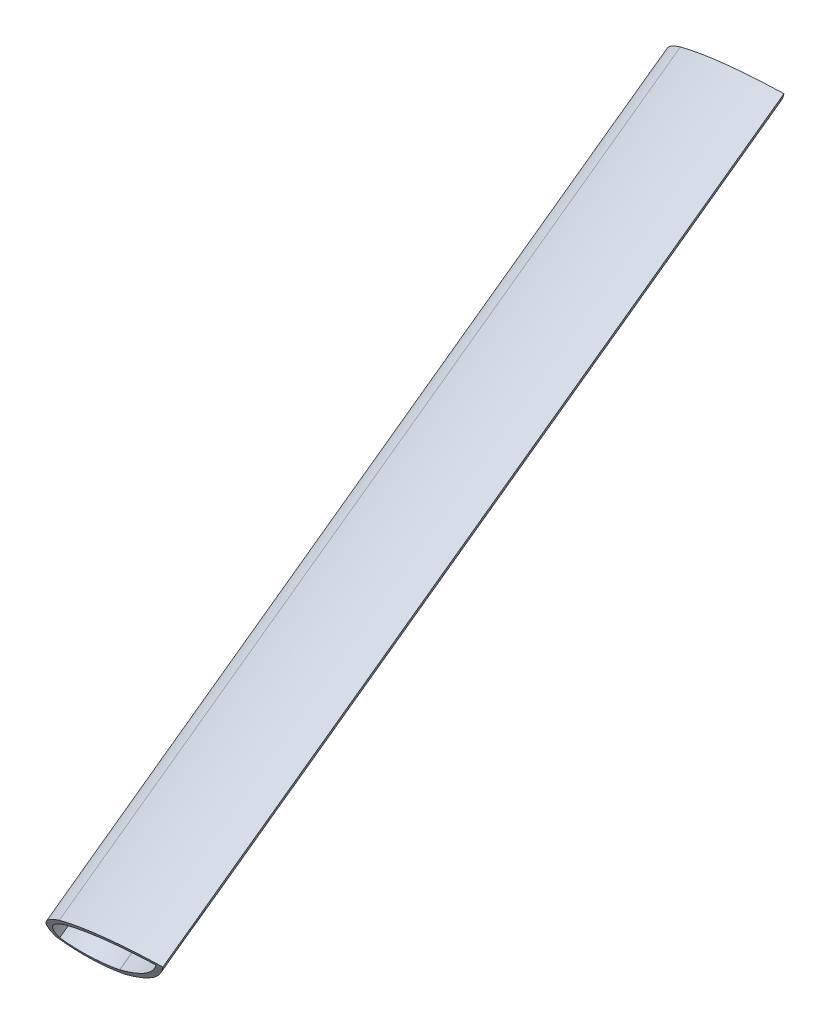
from build123d import *

# Parameters (mm, degrees)
BOSS_EXTRUDE1_DEPTH      = 91.359952
BOSS_EXTRUDE1_DEPTH_BACK = 91.359952
SKETCH1_R                = 6.35
SKETCH2_R                = 5.1943
CUT_EXTRUDE1_DEPTH       = 1020.644650611
EXTRUDE_THIN2_START      = -177.8
EXTRUDE_THIN2_DEPTH      = 177.8


# Read off the part's stored shape, not the designer's step: Extrude-Thin2
with BuildPart() as part:
    # Sketch1 → Boss-Extrude1 (new, two sides: drawn at the far end of the back side and taken through both)
    with BuildSketch(Plane(origin=(-797.858372093, 381.268468163, 361.489360836), x_dir=(0.9998902886126457, 0.009608155882865862, -0.011273600962007019), z_dir=(-0.014732692778449213, 0.5661762234602228, -0.8241525536888277)).offset(-BOSS_EXTRUDE1_DEPTH_BACK)):
        with Locations(Location((0, 0, 0), (0, 0, 90.088001086))):
            Circle(SKETCH1_R)
    extrude(amount=BOSS_EXTRUDE1_DEPTH + BOSS_EXTRUDE1_DEPTH_BACK)

    # Sketch2 → Cut-Extrude1 (cut, through all)
    with BuildSketch(Plane(origin=(-0.310230962, 11.922151452, -17.354440468), x_dir=(0.999890288612646, 0.009608155882749703, -0.011273600962086832), z_dir=(-0.014732692778449222, 0.5661762234602224, -0.8241525536888279))):
        with Locations(Location((-798.182837875, -520.172934132, 0), (0, 0, 270.088001086))):
            Circle(SKETCH2_R)
    extrude(amount=-CUT_EXTRUDE1_DEPTH, mode=Mode.SUBTRACT)


with BuildPart() as body_2:
    # Extrude-Thin2 outline → Extrude-Thin2 (new body)
    with BuildSketch(Plane(origin=(-0.310230962, 11.922151452, -17.354440468), x_dir=(-0.9998914679921496, -0.00834220575504257, 0.012143304313270938), z_dir=(-0.014732692778449226, 0.5661762234602217, -0.8241525536888284)).offset(EXTRUDE_THIN2_START)):
        with BuildLine():
            add(Edge.make_bspline(
                [(795.007403943, 512.444480964), (792.898832326, 513.716162183), (790.876982299, 515.117057901), (787.988681037, 517.417188527), (787.053117975, 518.21438231), (785.23640397, 519.869741584), (784.354204701, 520.729019996), (781.796982108, 523.3901752), (780.214112798, 525.272124548), (778.019643962, 528.241116236), (777.320291883, 529.252086912), (776.31726013, 530.799037937), (775.993088295, 531.321432242), (775.34485148, 532.366291694), (775.020733072, 532.88872142), (774.696614665, 533.411151146)],
                knots=[0, 0, 0, 0, 0.25, 0.25, 0.375, 0.375, 0.5, 0.5, 0.75, 0.75, 0.875, 0.875, 0.9375, 0.9375, 1, 1, 1, 1], degree=3))
            Line((795.007403943, 512.444480964), (795.192139039, 512.334444488))
            add(Edge.make_bspline(
                [(795.192139039, 512.334444488), (795.820659251, 512.014505469), (796.461986169, 511.727191335), (797.766110641, 511.207259179), (798.428497889, 510.973595907), (799.772806417, 510.556032006), (800.452591935, 510.372450513), (801.816227189, 510.07205513), (802.501964688, 509.954924004), (803.88371636, 509.807351912), (804.579705649, 509.776701036), (805.634083311, 509.818402312), (805.989339161, 509.847310141), (806.693578465, 509.938551358), (807.040945003, 510.000493885), (808.067844122, 510.238519077), (808.732238224, 510.466586402), (809.693938159, 510.928501806), (810.007225559, 511.10207874), (810.608415369, 511.482548524), (810.895772864, 511.693557881), (811.186337014, 511.899534791)],
                knots=[0, 0, 0, 0, 0.125, 0.125, 0.25, 0.25, 0.375, 0.375, 0.5, 0.5, 0.625, 0.625, 0.6875, 0.6875, 0.75, 0.75, 0.875, 0.875, 0.9375, 0.9375, 1, 1, 1, 1], degree=3))
            add(Edge.make_bspline(
                [(802.824178055, 525.525933285), (803.415067853, 525.141877964), (803.983569629, 524.729777367), (805.084606371, 523.860520869), (805.61754116, 523.403865824), (806.650104746, 522.448833612), (807.148417232, 521.952115017), (808.08922944, 520.921809356), (808.532960793, 520.386746599), (809.350508798, 519.264437037), (809.724494326, 518.677316278), (810.21478219, 517.743872092), (810.367122157, 517.421936823), (810.63971425, 516.766905357), (810.759520718, 516.435352914), (811.066210954, 515.427787282), (811.200580221, 514.738918347), (811.281121537, 513.675990605), (811.287384359, 513.318194206), (811.258437226, 512.607919011), (811.219408013, 512.253857446), (811.186337014, 511.899534791)],
                knots=[0, 0, 0, 0, 0.125, 0.125, 0.25, 0.25, 0.375, 0.375, 0.5, 0.5, 0.625, 0.625, 0.6875, 0.6875, 0.75, 0.75, 0.875, 0.875, 0.9375, 0.9375, 1, 1, 1, 1], degree=3))
            add(Edge.make_bspline(
                [(802.824178055, 525.525933285), (800.700286301, 526.77528344), (798.504727379, 527.888310329), (795.104625441, 529.334637361), (793.957375, 529.778259938), (791.635103666, 530.588520593), (790.458590691, 530.95555421), (786.898386756, 531.938184836), (784.488036247, 532.434463461), (780.829672903, 532.950837392), (779.606779988, 533.084498644), (777.76751946, 533.229941481), (777.153344334, 533.266248665), (775.9249795, 533.338699906), (775.310797082, 533.374925526), (774.696614665, 533.411151146)],
                knots=[0, 0, 0, 0, 0.25, 0.25, 0.375, 0.375, 0.5, 0.5, 0.75, 0.75, 0.875, 0.875, 0.9375, 0.9375, 1, 1, 1, 1], degree=3))
        make_face()
        with BuildLine():
            Line((795.805834227, 513.447123796), (795.657315978, 513.5355879))
            add(Edge.make_bspline(
                [(795.657315978, 513.5355879), (784.256115309, 520.41167093), (777.067204021, 531.999122223)],
                knots=[0, 0, 0, 1, 1, 1], degree=2))
            add(Edge.make_bspline(
                [(802.155834227, 524.445646424), (790.679875453, 531.196221565), (777.067204021, 531.999122223)],
                knots=[0, 0, 0, 1, 1, 1], degree=2))
            add(Edge.make_bspline(
                [(802.155834227, 524.445646424), (803.357131939, 523.664849768), (807.630718362, 520.192997769), (810.29114838, 515.974403166), (809.976037151, 512.598301742)],
                knots=[0, 0, 0, 0, 0.294150136, 1, 1, 1, 1], degree=3))
            add(Edge.make_bspline(
                [(795.805834227, 513.447123796), (797.082672823, 512.797167788), (802.226178064, 510.832059381), (807.209803167, 510.637356701), (809.976037151, 512.598301742)],
                knots=[0, 0, 0, 0, 0.294150136, 1, 1, 1, 1], degree=3))
        make_face(mode=Mode.SUBTRACT)
    extrude(amount=EXTRUDE_THIN2_DEPTH)


solid = body_2.part
